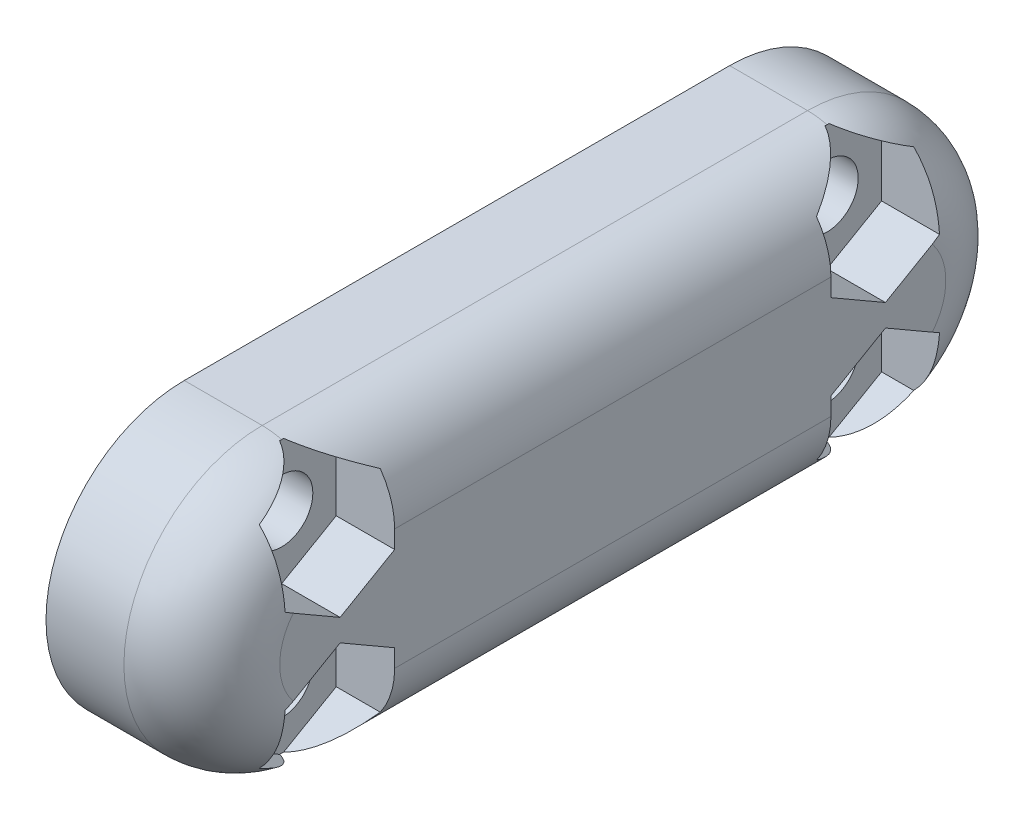
from build123d import *

# Parameters (mm, degrees)
BOSS_EXTRUDE1_DEPTH = 8
CUT_EXTRUDE5_REACH  = 35.361
SKETCH4_W           = 2
SKETCH4_H           = 4
SKETCH5_W           = 21
SKETCH5_H           = 3.6
CUT_EXTRUDE2_DEPTH  = 6.75
SKETCH6_R           = 1.6
CUT_EXTRUDE3_DEPTH  = 8
CUT_EXTRUDE4_DEPTH  = 3
FILLET1_R           = 4


with BuildPart() as part:
    # Sketch2 → Boss-Extrude1 (new body)
    with BuildSketch(Plane(origin=(0, 0, 0), x_dir=(0, 0, -1), z_dir=(1, 0, 0))):
        with BuildLine():
            Line((-3.5, 7.1), (24.5, 7.1))
            ThreePointArc((24.5, 7.1), (31.6, 0), (24.5, -7.1))
            Line((24.5, -7.1), (-3.5, -7.1))
            ThreePointArc((-3.5, -7.1), (-10.6, 0), (-3.5, 7.1))
        make_face()
    extrude(amount=BOSS_EXTRUDE1_DEPTH)

    # Sketch4 → Cut-Extrude5 (cut, up to next)
    with BuildSketch(Plane.XY, mode=Mode.PRIVATE) as cut_extrude5_sk1:
        with Locations((1, 0)):
            Rectangle(SKETCH4_W, SKETCH4_H)
    cut_extrude5_tool1 = extrude(cut_extrude5_sk1.sketch, amount=-CUT_EXTRUDE5_REACH, mode=Mode.PRIVATE) & part.part
    add(cut_extrude5_tool1.solids().sort_by_distance((1, 0, 0))[0], mode=Mode.SUBTRACT)

    # Sketch5 → Cut-Extrude2 (cut)
    with BuildSketch(Plane(origin=(0, 0, 0), x_dir=(0, 0, -1), z_dir=(1, 0, 0))):
        with Locations((10.5, 3.8)):
            Rectangle(SKETCH5_W, SKETCH5_H)
        with Locations((10.5, -3.8)):
            Rectangle(SKETCH5_W, SKETCH5_H)
    extrude(amount=CUT_EXTRUDE2_DEPTH, mode=Mode.SUBTRACT)

    # Sketch6 → Cut-Extrude3 (cut)
    with BuildSketch(Plane(origin=(8, 0, 0), x_dir=(0, 0, -1), z_dir=(1, 0, 0))):
        with Locations((-3.5, 3.8)):
            Circle(SKETCH6_R)
        with Locations((-3.5, -3.8)):
            Circle(SKETCH6_R)
        with Locations((24.5, 3.8)):
            Circle(SKETCH6_R)
        with Locations((24.5, -3.8)):
            Circle(SKETCH6_R)
    extrude(amount=-CUT_EXTRUDE3_DEPTH, mode=Mode.SUBTRACT)

    # Sketch7 → Cut-Extrude4 (cut)
    with BuildSketch(Plane(origin=(8, 0, 0), x_dir=(0, 0, -1), z_dir=(1, 0, 0))):
        Polygon((-0.7, 2.183419246), (-0.7, 5.416580754), (-3.5, 7.033161507), (-6.3, 5.416580754), (-6.3, 2.183419246), (-3.5, 0.566838493), align=None)
        Polygon((21.7, 5.416580754), (21.7, 2.183419246), (24.5, 0.566838493), (27.3, 2.183419246), (27.3, 5.416580754), (24.5, 7.033161507), align=None)
        Polygon((21.7, -2.183419246), (21.7, -5.416580754), (24.5, -7.033161507), (27.3, -5.416580754), (27.3, -2.183419246), (24.5, -0.566838493), align=None)
        Polygon((-3.5, -7.033161507), (-0.7, -5.416580754), (-0.7, -2.183419246), (-3.5, -0.566838493), (-6.3, -2.183419246), (-6.3, -5.416580754), align=None)
    extrude(amount=-CUT_EXTRUDE4_DEPTH, mode=Mode.SUBTRACT)

    # Fillet1
    # the kernel refuses this fillet: 4 mm, written as the material it takes off along each edge
    with BuildSketch(Plane(origin=(8, 7.1, 3.5), x_dir=(0, -1, 0), z_dir=(0, 0, -1))) as fillet1_piece_1:
        with BuildLine():
            CenterArc((FILLET1_R, FILLET1_R), FILLET1_R, 180, 90)
            Line((0, FILLET1_R), (0, 0))
            Line((0, 0), (FILLET1_R, 0))
        make_face()
    extrude(amount=28, mode=Mode.SUBTRACT)
    with BuildSketch(Plane(origin=(8, 0, -24.5), x_dir=(0, 1, 0), z_dir=(0, 0, 1))) as fillet1_piece_2:
        with BuildLine():
            CenterArc((7.1 - FILLET1_R, FILLET1_R), FILLET1_R, 270, 90)
            Line((7.1 - FILLET1_R, 0), (7.1, 0))
            Line((7.1, 0), (7.1, FILLET1_R))
        make_face()
    revolve(axis=Axis((8, 0, -24.5), (-1, 0, 0)), revolution_arc=180, mode=Mode.SUBTRACT)
    with BuildSketch(Plane(origin=(8, -7.1, -24.5), x_dir=(-1, 0, 0), z_dir=(0, 0, 1))) as fillet1_piece_3:
        with BuildLine():
            CenterArc((FILLET1_R, -FILLET1_R), FILLET1_R, 90, 90)
            Line((0, -FILLET1_R), (0, 0))
            Line((0, 0), (FILLET1_R, 0))
        make_face()
    extrude(amount=28, mode=Mode.SUBTRACT)
    with BuildSketch(Plane(origin=(8, 0, 3.5), x_dir=(0, -1, 0), z_dir=(0, 0, -1))) as fillet1_piece_4:
        with BuildLine():
            CenterArc((7.1 - FILLET1_R, FILLET1_R), FILLET1_R, 270, 90)
            Line((7.1, FILLET1_R), (7.1, 0))
            Line((7.1, 0), (7.1 - FILLET1_R, 0))
        make_face()
    revolve(axis=Axis((8, 0, 3.5), (-1, 0, 0)), revolution_arc=180, mode=Mode.SUBTRACT)


solid = part.part
